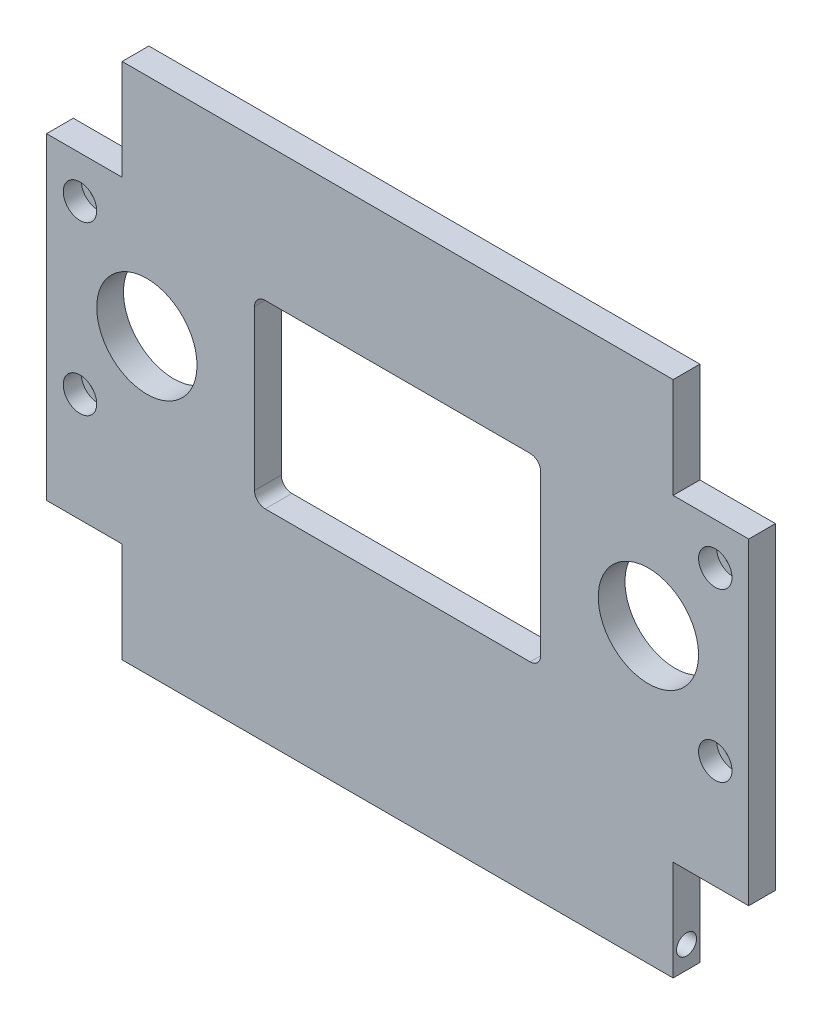
from build123d import *

# Parameters (mm, degrees)
SKETCH_1_W                   = 210
SKETCH_1_H                   = 75
EXTRUDE_1_DEPTH              = 8
CUT_EXTRUDE_1_DEPTH          = 224.134488594
HOLE_WIZARD_M5_1_D           = 5.5
HOLE_WIZARD_M5_1_DEPTH       = 10.1
HOLE_WIZARD_M5_1_CBORE_D     = 10
HOLE_WIZARD_M5_1_CBORE_DEPTH = 5.4
HOLE_WIZARD_M5_1_TIP         = 1.652366702
SKETCH_5_R                   = 15
CUT_EXTRUDE_2_DEPTH          = 13
SKETCH_6_W                   = 210
SKETCH_6_H                   = 8
EXTRUDE_2_DEPTH              = 50
SKETCH_7_W                   = 22.6
SKETCH_7_H                   = 30
CUT_EXTRUDE_3_DEPTH          = 20
SKETCH_9_R                   = 3
CUT_EXTRUDE_5_DEPTH          = 8
SKETCH_12_W                  = 164.8
SKETCH_12_H                  = 8
EXTRUDE_3_DEPTH              = 30


with BuildPart() as part:
    # 草图1 → 凸台-拉伸1 (new body)
    with BuildSketch(Plane.XY):
        with Locations((105, 37.5)):
            Rectangle(SKETCH_1_W, SKETCH_1_H)
    extrude(amount=EXTRUDE_1_DEPTH)

    # 草图2 → 切除-拉伸1 (cut, through all)
    with BuildSketch(Plane.XY.offset(8)):
        with BuildLine():
            Line((144.62, 64.5), (65.38, 64.5))
            ThreePointArc((65.38, 64.5), (63.131400436, 63.568599564), (62.2, 61.32))
            Line((62.2, 61.32), (62.2, 13.68))
            ThreePointArc((62.2, 13.68), (63.131400436, 11.431400436), (65.38, 10.5))
            Line((65.38, 10.5), (144.62, 10.5))
            ThreePointArc((144.62, 10.5), (146.868599564, 11.431400436), (147.8, 13.68))
            Line((147.8, 13.68), (147.8, 61.32))
            ThreePointArc((147.8, 61.32), (146.868599564, 63.568599564), (144.62, 64.5))
        make_face()
    extrude(amount=-CUT_EXTRUDE_1_DEPTH, mode=Mode.SUBTRACT)

    # M5 六角凹头螺钉的柱形沉头孔1
    with Locations(Plane.XY.offset(8)):
        with Locations((10, 62.5), (10, 12.5), (200, 62.5), (200, 12.5)):
            CounterBoreHole(HOLE_WIZARD_M5_1_D / 2, HOLE_WIZARD_M5_1_CBORE_D / 2, HOLE_WIZARD_M5_1_CBORE_DEPTH, depth=HOLE_WIZARD_M5_1_DEPTH)
            with Locations((0, 0, -(HOLE_WIZARD_M5_1_DEPTH + HOLE_WIZARD_M5_1_TIP / 2))):  # 118° drill point
                Cone(0, HOLE_WIZARD_M5_1_D / 2, HOLE_WIZARD_M5_1_TIP, mode=Mode.SUBTRACT)

    # 草图5 → 切除-拉伸2 (cut)
    with BuildSketch(Plane.XY.offset(8)):
        with Locations((30, 37.5)):
            Circle(SKETCH_5_R)
        with Locations((180, 37.5)):
            Circle(SKETCH_5_R)
    extrude(amount=-CUT_EXTRUDE_2_DEPTH, mode=Mode.SUBTRACT)

    # 草图6 → 凸台-拉伸2 (add)
    with BuildSketch(Plane.XZ):
        with Locations((105, 4)):
            Rectangle(SKETCH_6_W, SKETCH_6_H)
    extrude(amount=EXTRUDE_2_DEPTH)

    # 草图7 → 切除-拉伸3 (cut)
    with BuildSketch(Plane.XY.offset(8)):
        with Locations((11.3, -35)):
            Rectangle(SKETCH_7_W, SKETCH_7_H)
        with Locations((198.7, -35)):
            Rectangle(SKETCH_7_W, SKETCH_7_H)
    extrude(amount=-CUT_EXTRUDE_3_DEPTH, mode=Mode.SUBTRACT)

    # 草图9 → 切除-拉伸5 (cut)
    with BuildSketch(Plane.ZY.offset(-22.6)):
        with Locations((3.9960026, -43.291907347)):
            Circle(SKETCH_9_R)
    cut_extrude_5 = extrude(amount=-CUT_EXTRUDE_5_DEPTH, mode=Mode.SUBTRACT)

    # 镜向1: 切除-拉伸5 across plane
    add(cut_extrude_5.mirror(Plane.ZY.offset(-105)), mode=Mode.SUBTRACT)

    # 草图12 → 凸台-拉伸3 (add)
    with BuildSketch(Plane(origin=(0, 75, 0), x_dir=(1, 0, 0), z_dir=(0, 1, 0))):
        with Locations((105, -4)):
            Rectangle(SKETCH_12_W, SKETCH_12_H)
    extrude(amount=EXTRUDE_3_DEPTH)


solid = part.part
